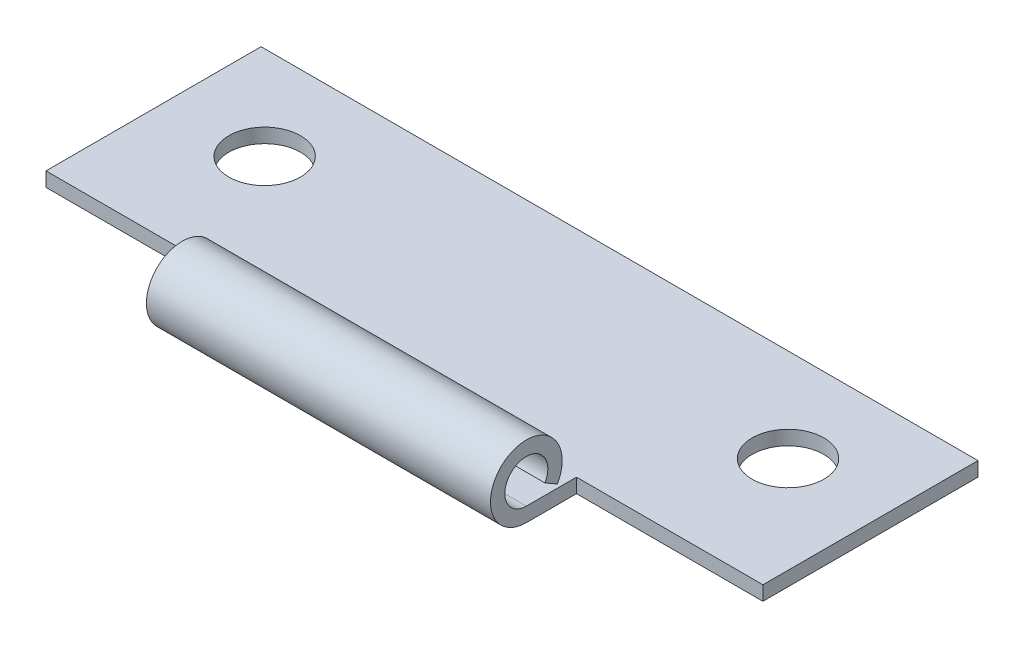
from build123d import *

# Parameters (mm, degrees)
SKETCH2_W               = 50
SKETCH2_H               = 21
BASE_FLANGE1_DEPTH      = 1
HEM1_START              = -25
HEM1_DEPTH              = 50
HEM1_2_DEPTH            = 50
CUT_EXTRUDE1_DEPTH      = 28.408940147
CUT_EXTRUDE1_DEPTH_BACK = 28.408940147
SKETCH5_W               = 13
SKETCH5_H               = 6
SKETCH6_R               = 2.5
CUT_EXTRUDE2_DEPTH      = 28.408940147


# Read off the part's stored shape, not the designer's step: Hem1
# Sheet-metal steps are written as plain solids
with BuildPart() as part:
    # Sketch2 → Base-Flange1 (new body)
    with BuildSketch(Plane(origin=(0, 0, 0), x_dir=(1, 0, 0), z_dir=(0, 1, 0))):
        Rectangle(SKETCH2_W, SKETCH2_H)
    extrude(amount=-BASE_FLANGE1_DEPTH)

    # Hem1 outline → Hem1 (cut)
    with BuildSketch(Plane.YZ.offset(HEM1_START)):
        with BuildLine():
            ThreePointArc((-1, 8), (-0.736067978, 9.118033989), (0, 10))
            Line((0, 10), (0, 10.5))
            Line((0, 10.5), (-1, 10.5))
            Line((-1, 10.5), (-1, 8))
        make_face()
    extrude(amount=HEM1_DEPTH, mode=Mode.SUBTRACT)

    # Hem1 2 outline → Hem1 2 (add)
    with BuildSketch(Plane.YZ.offset(HEM1_START)):
        with BuildLine():
            Line((0.75, 6.700961894), (0.25, 5.834936491))
            ThreePointArc((0.25, 5.834936491), (3.995508667, 8.149788152), (0, 10))
            Line((0, 10), (0, 8))
            ThreePointArc((0, 8), (2.799038106, 8.75), (0.75, 6.700961894))
        make_face()
    extrude(amount=HEM1_2_DEPTH)

    # Sketch5 → Cut-Extrude1 (cut, two sides: drawn at the far end of the back side and taken through both)
    with BuildSketch(Plane(origin=(0, 0, 0), x_dir=(1, 0, 0), z_dir=(0, 1, 0)).offset(-CUT_EXTRUDE1_DEPTH_BACK)):
        with Locations((18.5, -7.5)):
            Rectangle(SKETCH5_W, SKETCH5_H)
        with Locations((-18.5, -7.5)):
            Rectangle(SKETCH5_W, SKETCH5_H)
    extrude(amount=CUT_EXTRUDE1_DEPTH + CUT_EXTRUDE1_DEPTH_BACK, mode=Mode.SUBTRACT)

    # Sketch6 → Cut-Extrude2 (cut, through all)
    with BuildSketch(Plane(origin=(0, 0, 0), x_dir=(1, 0, 0), z_dir=(0, 1, 0))):
        with Locations(Location((18.25, 4, 0), (0, 0, 270))):
            Circle(SKETCH6_R)
        with Locations(Location((-18.25, 4, 0), (0, 0, 270))):
            Circle(SKETCH6_R)
    extrude(amount=-CUT_EXTRUDE2_DEPTH, mode=Mode.SUBTRACT)


solid = part.part
